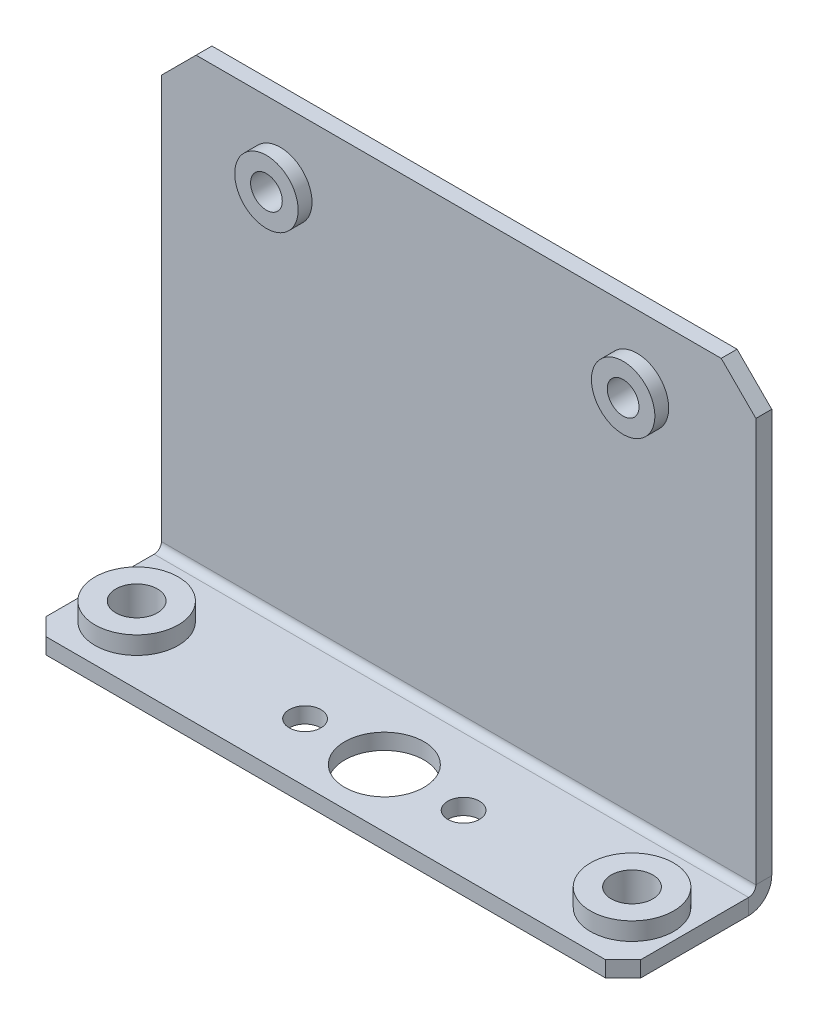
from build123d import *

# Parameters (mm, degrees)
SM_BASE_FLANGE_1_DEPTH           = 1.6
SM_EDGE_FLANGE_1_STRIP_W         = 7.8732
SM_EDGE_FLANGE_1_STRIP_H         = 1.6
SM_EDGE_FLANGE_1_STRIP_CUT_DEPTH = 60
SM_EDGE_FLANGE_1_DEPTH           = 60
CUT_EXTRUDE_1_DEPTH              = 56.718578589
SKETCH_9_R                       = 2.1
SKETCH_9_R_2                     = 1.6
SKETCH_9_R_3                     = 4
CUT_EXTRUDE_3_DEPTH              = 10
EXTRUDE_START                    = 1.8
SKETCH_10_R                      = 4.2
SKETCH_10_R_2                    = 2.1
EXTRUDE_2_DEPTH                  = 1.8
SKETCH_11_R                      = 3.2
EXTRUDE_3_DEPTH                  = 1.4
SKETCH_12_R                      = 1.6
CUT_EXTRUDE_4_DEPTH              = 56.398555938


# Sheet-metal steps are written as plain solids
with BuildPart() as part:
    # Sketch 1 → 基体-法兰1 (new body)
    with BuildSketch(Plane.XY):
        Polygon((-26.5, 45), (26.5, 45), (30, 41.5), (30, 0), (-30, 0), (-30, 41.5), align=None)
    extrude(amount=-SM_BASE_FLANGE_1_DEPTH)

    # 边线-法兰1 strip (across the edge) → 边线-法兰1 strip cut (cut)
    with BuildSketch(Plane.YZ.offset(-30)):
        with Locations((-3.2, -0.8)):
            Rectangle(SM_EDGE_FLANGE_1_STRIP_W, SM_EDGE_FLANGE_1_STRIP_H)
    extrude(amount=SM_EDGE_FLANGE_1_STRIP_CUT_DEPTH, mode=Mode.SUBTRACT)

    # 边线-法兰1 section (across the edge) → 边线-法兰1 (add)
    with BuildSketch(Plane.YZ.offset(-30)):
        with BuildLine():
            Line((-1.6, 0.7366), (-1.6, 13.4))
            Line((-1.6, 13.4), (0, 13.4))
            Line((0, 13.4), (0, 0.7366))
            ThreePointArc((0, 0.7366), (0.215745145, 0.215745145), (0.7366, 0))
            Line((0.7366, 0), (0.7366, -1.6))
            ThreePointArc((0.7366, -1.6), (-0.915625705, -0.915625705), (-1.6, 0.7366))
        make_face()
    extrude(amount=SM_EDGE_FLANGE_1_DEPTH)

    # 草图8 → 切除-拉伸1 (cut, through all)
    with BuildSketch(Plane(origin=(0, 0, 0), x_dir=(1, 0, 0), z_dir=(0, 1, 0))):
        Polygon((-30, -11.622497289), (-28.222497289, -13.4), (-30, -13.4), align=None)
        Polygon((28.222497289, -13.4), (30, -13.4), (30, -11.622497289), align=None)
    extrude(amount=-CUT_EXTRUDE_1_DEPTH, mode=Mode.SUBTRACT)

    # 草图9 → 切除-拉伸3 (cut)
    with BuildSketch(Plane(origin=(0, 0, 0), x_dir=(1, 0, 0), z_dir=(0, 1, 0))):
        with Locations(Location((-25, -7.5, 0), (0, 0, 270))):
            Circle(SKETCH_9_R)
        with Locations(Location((-8, -7.5, 0), (0, 0, 270))):
            Circle(SKETCH_9_R_2)
        with Locations(Location((0, -7.5, 0), (0, 0, 270))):
            Circle(SKETCH_9_R_3)
        with Locations(Location((25, -7.5, 0), (0, 0, 270))):
            Circle(SKETCH_9_R)
        with Locations(Location((8, -7.5, 0), (0, 0, 270))):
            Circle(SKETCH_9_R_2)
    extrude(amount=-CUT_EXTRUDE_3_DEPTH, mode=Mode.SUBTRACT)

    # 草图10 → 凸台-拉伸2 (add)
    # profile 1 of 2: a face of its own
    with BuildSketch(Plane(origin=(0, 0, 0), x_dir=(1, 0, 0), z_dir=(0, 1, 0)).offset(EXTRUDE_START)):
        with Locations(Location((-25, -7.5, 0), (0, 0, 270))):
            Circle(SKETCH_10_R)
        with Locations(Location((-25, -7.5, 0), (0, 0, 270))):
            Circle(SKETCH_10_R_2, mode=Mode.SUBTRACT)
    # profile 2 of 2: a face of its own
    with BuildSketch(Plane(origin=(0, 0, 0), x_dir=(1, 0, 0), z_dir=(0, 1, 0)).offset(EXTRUDE_START)):
        with Locations(Location((25, -7.5, 0), (0, 0, 90))):
            Circle(SKETCH_10_R)
        with Locations(Location((25, -7.5, 0), (0, 0, 270))):
            Circle(SKETCH_10_R_2, mode=Mode.SUBTRACT)
    extrude(amount=-EXTRUDE_2_DEPTH)

    # 草图11 → 凸台-拉伸3 (add)
    with BuildSketch(Plane.XY):
        with Locations((-18, 38)):
            Circle(SKETCH_11_R)
        with Locations(Location((18, 38, 0), (0, 0, 180))):
            Circle(SKETCH_11_R)
    extrude(amount=EXTRUDE_3_DEPTH)

    # 草图12 → 切除-拉伸4 (cut, through all)
    with BuildSketch(Plane.XY.offset(1.4)):
        with Locations((-18, 38)):
            Circle(SKETCH_12_R)
        with Locations(Location((18, 38, 0), (0, 0, 180))):
            Circle(SKETCH_12_R)
    extrude(amount=-CUT_EXTRUDE_4_DEPTH, mode=Mode.SUBTRACT)


solid = part.part
